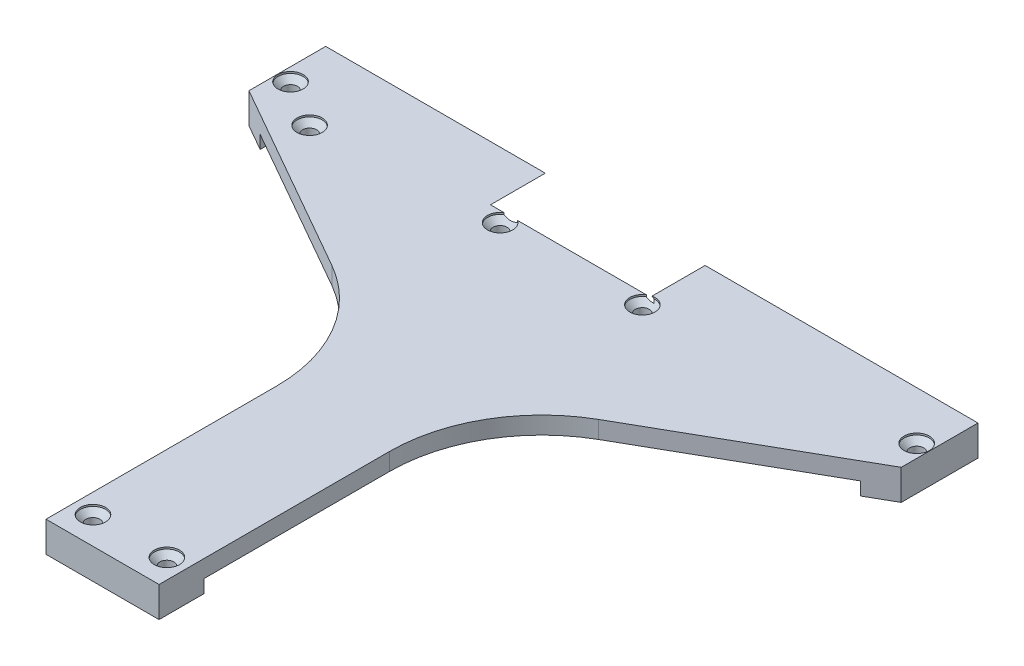
from build123d import *

# Parameters (mm, degrees)
BOSS_EXTRU_1_DEPTH       = 4
BOSS_EXTRU_6_DEPTH       = 3
ESQUISSE22_W             = 26
ESQUISSE22_H             = 11.3
BOSS_EXTRU_7_DEPTH       = 3
ENL_V_MAT_EXTRU_9_DEPTH  = 12.6
ENL_V_MAT_EXTRU_10_REACH = 149.934
ESQUISSE23_W             = 26
ESQUISSE23_H             = 1


# Read off the part's stored shape, not the designer's step: Fraisage pour vis à tête fraisée à 6 pans creux M31
with BuildPart() as part:
    # Esquisse1 → Boss.-Extru.1 (new body)
    with BuildSketch(Plane(origin=(0, 0, 0), x_dir=(1, 0, 0), z_dir=(0, 1, 0))):
        with BuildLine():
            Line((-13, -127.32), (-13, -73.32))
            ThreePointArc((-13, -73.32), (-17.738590223, -55.734577677), (-30.671261616, -42.910875941))
            Line((-30.671261616, -42.910875941), (-75, -17.65))
            Line((-75, -17.65), (-75, 0))
            Line((-75, 0), (75, 0))
            Line((75, 0), (75, -17.65))
            Line((75, -17.65), (30.671261616, -42.910875941))
            ThreePointArc((30.671261616, -42.910875941), (17.738590223, -55.734577677), (13, -73.32))
            Line((13, -73.32), (13, -127.32))
            Line((13, -127.32), (-13, -127.32))
        make_face()
    extrude(amount=BOSS_EXTRU_1_DEPTH)

    # Esquisse21 → Boss.-Extru.6 (add)
    with BuildSketch(Plane(origin=(0, 0, 0), x_dir=(-1, 0, 0), z_dir=(0, -1, 0))):
        Polygon((75, 0), (69, 0), (69, -21.069119541), (75, -17.65), align=None)
        Polygon((-75, 0), (-69, 0), (-69, -21.069119541), (-75, -17.65), align=None)
    extrude(amount=BOSS_EXTRU_6_DEPTH)

    # Esquisse22 → Boss.-Extru.7 (add)
    with BuildSketch(Plane.XZ):
        with Locations((0, 121.67)):
            Rectangle(ESQUISSE22_W, ESQUISSE22_H)
    extrude(amount=BOSS_EXTRU_7_DEPTH)

    # Fraisage pour vis _ t_te frais_e _ 6 2 → Fraisage pour vis à tête fraisée à 6 pans creux M31 (revolve, cut)
    with BuildSketch(Plane(origin=(8.5, 0, 120.02), x_dir=(1, 0, 0), z_dir=(0, 0, 1))):
        Polygon((0, -3), (1.6, -3), (1.6, 2.3), (2.9, 3.6), (2.9, 4), (0, 4), align=None)
    revolve(axis=Axis((8.5, 0, 120.02), (0, 1, 0)), mode=Mode.SUBTRACT)

    # Fraisage pour vis _ t_te frais_e _ 6 3 o → Fraisage pour vis _ t_te frais_e _ 6 3 (revolve, cut)
    with BuildSketch(Plane(origin=(-8.5, 0, 120.02), x_dir=(1, 0, 0), z_dir=(0, 0, 1))):
        Polygon((0, -3), (1.6, -3), (1.6, 2.3), (2.9, 3.6), (2.9, 4), (0, 4), align=None)
    revolve(axis=Axis((-8.5, 0, 120.02), (0, 1, 0)), mode=Mode.SUBTRACT)

    # Fraisage pour vis _ t_te frais_e _ 6 4 o → Fraisage pour vis _ t_te frais_e _ 6 4 (revolve, cut)
    with BuildSketch(Plane(origin=(-61.15, 0, 17.55), x_dir=(1, 0, 0), z_dir=(0, 0, 1))):
        Polygon((0, 0), (1.6, 0), (1.6, 2.3), (2.9, 3.6), (2.9, 4), (0, 4), align=None)
    revolve(axis=Axis((-61.15, 0, 17.55), (0, 1, 0)), mode=Mode.SUBTRACT)

    # Fraisage pour vis _ t_te frais_e _ 6 5 o → Fraisage pour vis _ t_te frais_e _ 6 5 (revolve, cut)
    with BuildSketch(Plane(origin=(-72, 0, 11.09), x_dir=(1, 0, 0), z_dir=(0, 0, 1))):
        Polygon((0, -3), (1.6, -3), (1.6, 2.3), (2.9, 3.6), (2.9, 4), (0, 4), align=None)
    revolve(axis=Axis((-72, 0, 11.09), (0, 1, 0)), mode=Mode.SUBTRACT)

    # Fraisage pour vis _ t_te frais_e _ 6 6 o → Fraisage pour vis _ t_te frais_e _ 6 6 (revolve, cut)
    with BuildSketch(Plane(origin=(72, 0, 11.09), x_dir=(1, 0, 0), z_dir=(0, 0, 1))):
        Polygon((0, -3), (1.6, -3), (1.6, 2.3), (2.9, 3.6), (2.9, 4), (0, 4), align=None)
    revolve(axis=Axis((72, 0, 11.09), (0, 1, 0)), mode=Mode.SUBTRACT)

    # Fraisage pour vis _ t_te frais_e _ 6 7 o → Fraisage pour vis _ t_te frais_e _ 6 7 (revolve, cut)
    with BuildSketch(Plane(origin=(12.87, 0, 15.05), x_dir=(1, 0, 0), z_dir=(0, 0, 1))):
        Polygon((0, 0), (1.6, 0), (1.6, 2.3), (2.9, 3.6), (2.9, 4), (0, 4), align=None)
    revolve(axis=Axis((12.87, 0, 15.05), (0, 1, 0)), mode=Mode.SUBTRACT)

    # Fraisage pour vis _ t_te frais_e _ 6 8 o → Fraisage pour vis _ t_te frais_e _ 6 8 (revolve, cut)
    with BuildSketch(Plane(origin=(-19.84, 0, 15.05), x_dir=(1, 0, 0), z_dir=(0, 0, 1))):
        Polygon((0, 0), (1.6, 0), (1.6, 2.3), (2.9, 3.6), (2.9, 4), (0, 4), align=None)
    revolve(axis=Axis((-19.84, 0, 15.05), (0, 1, 0)), mode=Mode.SUBTRACT)

    # Esquisse16 → Enlèv. mat.-Extru.9 (cut)
    with BuildSketch(Plane(origin=(0, 0, 0), x_dir=(-1, 0, 0), z_dir=(0, 0, -1))):
        Polygon((28.5, 0), (24.5, 4), (-12.25, 4), (-16.25, 0), align=None)
    extrude(amount=-ENL_V_MAT_EXTRU_9_DEPTH, mode=Mode.SUBTRACT)

    # Esquisse23 → Enlèv. mat.-Extru.10 (cut, up to next)
    with BuildSketch(Plane(origin=(0, 4, 0), x_dir=(1, 0, 0), z_dir=(0, 1, 0)), mode=Mode.PRIVATE) as enl_v_mat_extru_10_sk1:
        with Locations((0, -126.82)):
            Rectangle(ESQUISSE23_W, ESQUISSE23_H)
    enl_v_mat_extru_10_tool1 = extrude(enl_v_mat_extru_10_sk1.sketch, amount=-ENL_V_MAT_EXTRU_10_REACH, mode=Mode.PRIVATE) & part.part
    add(enl_v_mat_extru_10_tool1.solids().sort_by_distance((0, 4, 126.82))[0], mode=Mode.SUBTRACT)


solid = part.part
